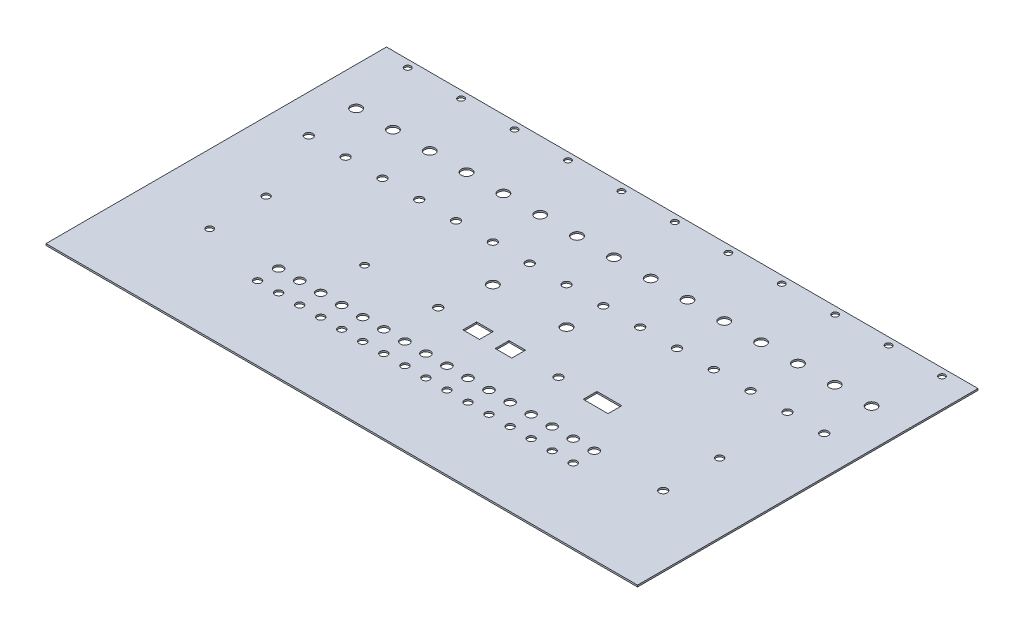
from build123d import *

# Parameters (mm, degrees)
SKETCH1_W            = 562.3
SKETCH1_H            = 323.65
BOSS_EXTRUDE1_DEPTH  = 1.5875
CUT_EXTRUDE2_REACH   = 326.4
SKETCH6_R            = 3.5
LPATTERN2_COUNT      = 16
LPATTERN2_PITCH      = 20
CUT_EXTRUDE3_REACH   = 326.4
SKETCH7_R            = 4.25
LPATTERN3_COUNT      = 16
LPATTERN3_PITCH      = 20
CUT_EXTRUDE4_REACH   = 326.4
SKETCH8_R            = 3.3
CUT_EXTRUDE7_REACH   = 326.4
SKETCH15_W           = 23.61
SKETCH15_H           = 13.08
CUT_EXTRUDE8_REACH   = 326.4
SKETCH16_R           = 3.8
CUT_EXTRUDE9_REACH   = 326.4
SKETCH18_W           = 15.74
SKETCH18_H           = 13.08
CUT_EXTRUDE10_REACH  = 326.4
SKETCH19_W           = 15.74
SKETCH19_H           = 13.08
CUT_EXTRUDE12_REACH  = 326.4
SKETCH24_R           = 3.5
CUT_EXTRUDE13_REACH  = 326.4
SKETCH26_R           = 3.5
M7_CLEARANCE_HOLE1_D = 7.6
LPATTERN4_COUNT      = 15
LPATTERN4_PITCH      = 35
CUT_EXTRUDE14_REACH  = 326.4
SKETCH33_R           = 5
LPATTERN5_COUNT      = 15
LPATTERN5_PITCH      = 35
CUT_EXTRUDE15_REACH  = 326.4
SKETCH34_R           = 5
LPATTERN6_COUNT      = 2
LPATTERN6_PITCH      = 70
M7_CLEARANCE_HOLE3_D = 7.6
M7_CLEARANCE_HOLE5_D = 7.6
CUT_EXTRUDE16_REACH  = 326.4
SKETCH43_R           = 3
LPATTERN7_COUNT      = 11
LPATTERN7_PITCH      = 50.8
CUT_EXTRUDE17_REACH  = 326.4
SKETCH44_R           = 3.3


with BuildPart() as part:
    # Sketch1 → Boss-Extrude1 (new body)
    with BuildSketch(Plane(origin=(0, 0, 0), x_dir=(1, 0, 0), z_dir=(0, 1, 0))):
        Rectangle(SKETCH1_W, SKETCH1_H)
    extrude(amount=BOSS_EXTRUDE1_DEPTH)

    # Sketch6 → Cut-Extrude2 (cut, up to next)
    with BuildSketch(Plane(origin=(0, 1.5875, 0), x_dir=(1, 0, 0), z_dir=(0, 1, 0)), mode=Mode.PRIVATE) as cut_extrude2_sk1:
        with Locations((-150, -91.825)):
            Circle(SKETCH6_R)
    cut_extrude2_tool1 = extrude(cut_extrude2_sk1.sketch, amount=-CUT_EXTRUDE2_REACH, mode=Mode.PRIVATE) & part.part
    cut_extrude2 = cut_extrude2_tool1.solids().sort_by_distance((-150, 1.5875, 91.825))[0]
    add(cut_extrude2, mode=Mode.SUBTRACT)

    # LPattern2: Cut-Extrude2 ×16
    with Locations(*[(i * LPATTERN2_PITCH, 0, 0) for i in range(1, LPATTERN2_COUNT)]):
        add(cut_extrude2, mode=Mode.SUBTRACT)

    # Sketch7 → Cut-Extrude3 (cut, up to next)
    with BuildSketch(Plane(origin=(0, 1.5875, 0), x_dir=(1, 0, 0), z_dir=(0, 1, 0)), mode=Mode.PRIVATE) as cut_extrude3_sk1:
        with Locations((-150, -71.825)):
            Circle(SKETCH7_R)
    cut_extrude3_tool1 = extrude(cut_extrude3_sk1.sketch, amount=-CUT_EXTRUDE3_REACH, mode=Mode.PRIVATE) & part.part
    cut_extrude3 = cut_extrude3_tool1.solids().sort_by_distance((-150, 1.5875, 71.825))[0]
    add(cut_extrude3, mode=Mode.SUBTRACT)

    # LPattern3: Cut-Extrude3 ×16
    with Locations(*[(i * LPATTERN3_PITCH, 0, 0) for i in range(1, LPATTERN3_COUNT)]):
        add(cut_extrude3, mode=Mode.SUBTRACT)

    # Sketch8 → Cut-Extrude4 (cut, up to next)
    with BuildSketch(Plane(origin=(0, 1.5875, 0), x_dir=(1, 0, 0), z_dir=(0, 1, 0)), mode=Mode.PRIVATE) as cut_extrude4_sk1:
        with Locations((-215.575, -71.825)):
            Circle(SKETCH8_R)
    cut_extrude4_tool1 = extrude(cut_extrude4_sk1.sketch, amount=-CUT_EXTRUDE4_REACH, mode=Mode.PRIVATE) & part.part
    add(cut_extrude4_tool1.solids().sort_by_distance((-215.575, 1.5875, 71.825))[0], mode=Mode.SUBTRACT)

    # Sketch15 → Cut-Extrude7 (cut, up to next)
    with BuildSketch(Plane(origin=(0, 1.5875, 0), x_dir=(1, 0, 0), z_dir=(0, 1, 0)), mode=Mode.PRIVATE) as cut_extrude7_sk1:
        with Locations((114.202396417, -28.175)):
            Rectangle(SKETCH15_W, SKETCH15_H)
    cut_extrude7_tool1 = extrude(cut_extrude7_sk1.sketch, amount=-CUT_EXTRUDE7_REACH, mode=Mode.PRIVATE) & part.part
    add(cut_extrude7_tool1.solids().sort_by_distance((114.202396, 1.5875, 28.175))[0], mode=Mode.SUBTRACT)

    # Sketch16 → Cut-Extrude8 (cut, up to next)
    with BuildSketch(Plane(origin=(0, 1.5875, 0), x_dir=(1, 0, 0), z_dir=(0, 1, 0)), mode=Mode.PRIVATE) as cut_extrude8_sk1:
        with Locations((-41.952521652, -28.175)):
            Circle(SKETCH16_R)
    cut_extrude8_tool1 = extrude(cut_extrude8_sk1.sketch, amount=-CUT_EXTRUDE8_REACH, mode=Mode.PRIVATE) & part.part
    add(cut_extrude8_tool1.solids().sort_by_distance((-41.952522, 1.5875, 28.175))[0], mode=Mode.SUBTRACT)

    # Sketch18 → Cut-Extrude9 (cut, up to next)
    with BuildSketch(Plane(origin=(0, 1.5875, 0), x_dir=(1, 0, 0), z_dir=(0, 1, 0)), mode=Mode.PRIVATE) as cut_extrude9_sk1:
        with Locations((-4.082521652, -28.175)):
            Rectangle(SKETCH18_W, SKETCH18_H)
    cut_extrude9_tool1 = extrude(cut_extrude9_sk1.sketch, amount=-CUT_EXTRUDE9_REACH, mode=Mode.PRIVATE) & part.part
    add(cut_extrude9_tool1.solids().sort_by_distance((-4.082522, 1.5875, 28.175))[0], mode=Mode.SUBTRACT)

    # Sketch19 → Cut-Extrude10 (cut, up to next)
    with BuildSketch(Plane(origin=(0, 1.5875, 0), x_dir=(1, 0, 0), z_dir=(0, 1, 0)), mode=Mode.PRIVATE) as cut_extrude10_sk1:
        with Locations((26.657478348, -28.175)):
            Rectangle(SKETCH19_W, SKETCH19_H)
    cut_extrude10_tool1 = extrude(cut_extrude10_sk1.sketch, amount=-CUT_EXTRUDE10_REACH, mode=Mode.PRIVATE) & part.part
    add(cut_extrude10_tool1.solids().sort_by_distance((26.657478, 1.5875, 28.175))[0], mode=Mode.SUBTRACT)

    # Sketch24 → Cut-Extrude12 (cut, up to next)
    with BuildSketch(Plane(origin=(0, 1.5875, 0), x_dir=(1, 0, 0), z_dir=(0, 1, 0)), mode=Mode.PRIVATE) as cut_extrude12_sk1:
        with Locations((-215.57, -18.175)):
            Circle(SKETCH24_R)
    cut_extrude12_tool1 = extrude(cut_extrude12_sk1.sketch, amount=-CUT_EXTRUDE12_REACH, mode=Mode.PRIVATE) & part.part
    add(cut_extrude12_tool1.solids().sort_by_distance((-215.57, 1.5875, 18.175))[0], mode=Mode.SUBTRACT)

    # Sketch26 → Cut-Extrude13 (cut, up to next)
    with BuildSketch(Plane(origin=(0, 1.5875, 0), x_dir=(1, 0, 0), z_dir=(0, 1, 0)), mode=Mode.PRIVATE) as cut_extrude13_sk1:
        with Locations((215.57, -18.175)):
            Circle(SKETCH26_R)
    cut_extrude13_tool1 = extrude(cut_extrude13_sk1.sketch, amount=-CUT_EXTRUDE13_REACH, mode=Mode.PRIVATE) & part.part
    add(cut_extrude13_tool1.solids().sort_by_distance((215.57, 1.5875, 18.175))[0], mode=Mode.SUBTRACT)

    # M7 Clearance Hole1 (through all)
    with Locations(Plane(origin=(0, 1.5875, 0), x_dir=(1, 0, 0), z_dir=(0, 1, 0))):
        with Locations((-245, 51.825)):
            m7_clearance_hole1 = Hole(M7_CLEARANCE_HOLE1_D / 2)

    # LPattern4: M7 Clearance Hole1 ×15
    with Locations(*[(i * LPATTERN4_PITCH, 0, 0) for i in range(1, LPATTERN4_COUNT)]):
        add(m7_clearance_hole1, mode=Mode.SUBTRACT)

    # Sketch33 → Cut-Extrude14 (cut, up to next)
    with BuildSketch(Plane(origin=(0, 1.5875, 0), x_dir=(1, 0, 0), z_dir=(0, 1, 0)), mode=Mode.PRIVATE) as cut_extrude14_sk1:
        with Locations((-245, 96.825)):
            Circle(SKETCH33_R)
    cut_extrude14_tool1 = extrude(cut_extrude14_sk1.sketch, amount=-CUT_EXTRUDE14_REACH, mode=Mode.PRIVATE) & part.part
    cut_extrude14 = cut_extrude14_tool1.solids().sort_by_distance((-245, 1.5875, -96.825))[0]
    add(cut_extrude14, mode=Mode.SUBTRACT)

    # LPattern5: Cut-Extrude14 ×15
    with Locations(*[(i * LPATTERN5_PITCH, 0, 0) for i in range(1, LPATTERN5_COUNT)]):
        add(cut_extrude14, mode=Mode.SUBTRACT)

    # Sketch34 → Cut-Extrude15 (cut, up to next)
    with BuildSketch(Plane(origin=(0, 1.5875, 0), x_dir=(1, 0, 0), z_dir=(0, 1, 0)), mode=Mode.PRIVATE) as cut_extrude15_sk1:
        with Locations((-35, 16.825)):
            Circle(SKETCH34_R)
    cut_extrude15_tool1 = extrude(cut_extrude15_sk1.sketch, amount=-CUT_EXTRUDE15_REACH, mode=Mode.PRIVATE) & part.part
    cut_extrude15 = cut_extrude15_tool1.solids().sort_by_distance((-35, 1.5875, -16.825))[0]
    add(cut_extrude15, mode=Mode.SUBTRACT)

    # LPattern6: Cut-Extrude15 ×2
    with Locations(*[(i * LPATTERN6_PITCH, 0, 0) for i in range(1, LPATTERN6_COUNT)]):
        add(cut_extrude15, mode=Mode.SUBTRACT)

    # M7 Clearance Hole3 (through all)
    with Locations(Plane(origin=(0, 1.5875, 0), x_dir=(1, 0, 0), z_dir=(0, 1, 0))):
        with Locations((72.397396417, -28.165)):
            Hole(M7_CLEARANCE_HOLE3_D / 2)

    # M7 Clearance Hole5 (through all)
    with Locations(Plane(origin=(0, 1.5875, 0), x_dir=(1, 0, 0), z_dir=(0, 1, 0))):
        with Locations((215.57, -71.825)):
            Hole(M7_CLEARANCE_HOLE5_D / 2)

    # Sketch43 → Cut-Extrude16 (cut, up to next)
    with BuildSketch(Plane(origin=(0, 1.5875, 0), x_dir=(1, 0, 0), z_dir=(0, 1, 0)), mode=Mode.PRIVATE) as cut_extrude16_sk1:
        with Locations((-254, 154.825)):
            Circle(SKETCH43_R)
    cut_extrude16_tool1 = extrude(cut_extrude16_sk1.sketch, amount=-CUT_EXTRUDE16_REACH, mode=Mode.PRIVATE) & part.part
    cut_extrude16 = cut_extrude16_tool1.solids().sort_by_distance((-254, 1.5875, -154.825))[0]
    add(cut_extrude16, mode=Mode.SUBTRACT)

    # LPattern7: Cut-Extrude16 ×11
    with Locations(*[(i * LPATTERN7_PITCH, 0, 0) for i in range(1, LPATTERN7_COUNT)]):
        add(cut_extrude16, mode=Mode.SUBTRACT)

    # Sketch44 → Cut-Extrude17 (cut, up to next)
    with BuildSketch(Plane(origin=(0, 1.5875, 0), x_dir=(1, 0, 0), z_dir=(0, 1, 0)), mode=Mode.PRIVATE) as cut_extrude17_sk1:
        with Locations((-111.952521652, -28.175)):
            Circle(SKETCH44_R)
    cut_extrude17_tool1 = extrude(cut_extrude17_sk1.sketch, amount=-CUT_EXTRUDE17_REACH, mode=Mode.PRIVATE) & part.part
    add(cut_extrude17_tool1.solids().sort_by_distance((-111.952522, 1.5875, 28.175))[0], mode=Mode.SUBTRACT)


solid = part.part
